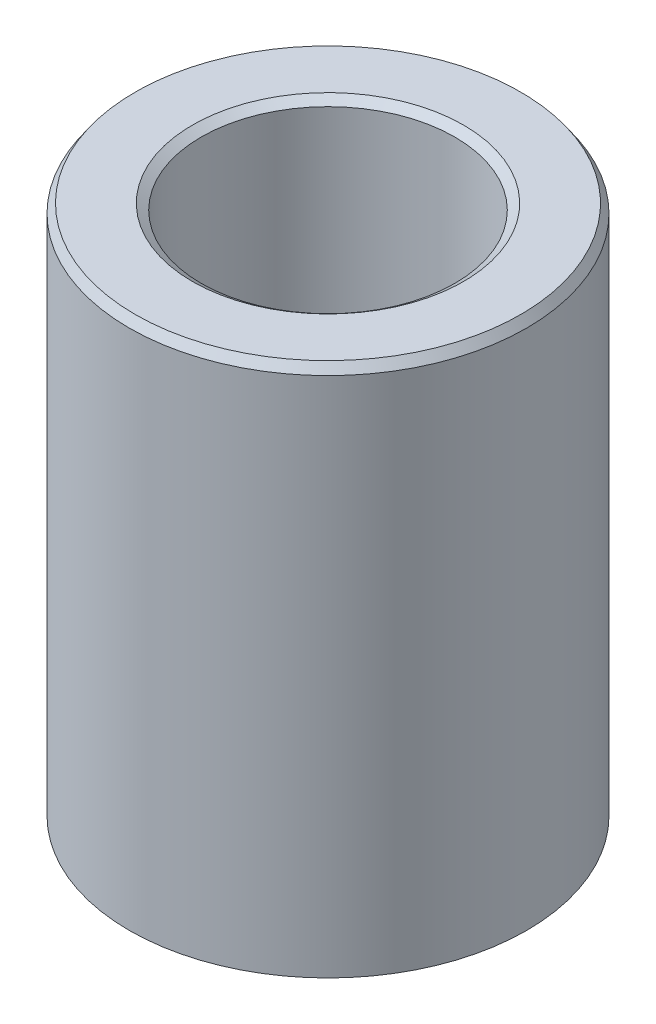
from build123d import *
from OCP.BRepFilletAPI import BRepFilletAPI_MakeChamfer

# Parameters (mm, degrees)
SKETCH1_R           = 47.5
BOSS_EXTRUDE1_DEPTH = 128.229420017
SKETCH2_R           = 30.314714834
CUT_EXTRUDE1_DEPTH  = 145.759400931
CHAMFER1_SIZE       = 2.090935507
CHAMFER1_SIZE2      = 1.429534085


with BuildPart() as part:
    # Sketch1 → Boss-Extrude1 (new body)
    with BuildSketch(Plane(origin=(0, 0, 0), x_dir=(1, 0, 0), z_dir=(0, 1, 0))):
        Circle(SKETCH1_R)
    extrude(amount=BOSS_EXTRUDE1_DEPTH)

    # Sketch2 → Cut-Extrude1 (cut, through all)
    with BuildSketch(Plane(origin=(0, 0, 0), x_dir=(1, 0, 0), z_dir=(0, 1, 0))):
        Circle(SKETCH2_R)
    extrude(amount=CUT_EXTRUDE1_DEPTH, mode=Mode.SUBTRACT)

    # Chamfer1: one chamfer whose edges measure the first distance from different faces: ONE call of the kernel's chamfer builder (chamfer() names one face for all edges)
    chamfer1_edges_1 = [part.edges().sort_by_distance(p)[0] for p in [
        (-30.314714834, 128.229420017, 0),
    ]]
    chamfer1_side_1 = [part.faces().sort_by_distance(p)[0] for p in [
        (-46.156497116, 128.229420017, 0),
    ]]
    chamfer1_edges_2 = [part.edges().sort_by_distance(p)[0] for p in [
        (-30.314714834, 0, 0),
    ]]
    chamfer1_side_2 = [part.faces().sort_by_distance(p)[0] for p in [
        (-30.314714834, 64.114710009, 0),
    ]]
    chamfer1_edges_3 = [part.edges().sort_by_distance(p)[0] for p in [
        (-47.5, 0, 0),
    ]]
    chamfer1_side_3 = [part.faces().sort_by_distance(p)[0] for p in [
        (-46.156497116, 0, 0),
    ]]
    chamfer1_edges_4 = [part.edges().sort_by_distance(p)[0] for p in [
        (-47.5, 128.229420017, 0),
    ]]
    chamfer1_side_4 = [part.faces().sort_by_distance(p)[0] for p in [
        (-47.5, 64.114710009, 0),
    ]]
    chamfer1 = BRepFilletAPI_MakeChamfer(part.part.solid().wrapped)
    for e in chamfer1_edges_1:
        chamfer1.Add(CHAMFER1_SIZE, CHAMFER1_SIZE2, e.wrapped, chamfer1_side_1[0].wrapped)  # the first distance lies on this face
    for e in chamfer1_edges_2:
        chamfer1.Add(CHAMFER1_SIZE, CHAMFER1_SIZE2, e.wrapped, chamfer1_side_2[0].wrapped)  # the first distance lies on this face
    for e in chamfer1_edges_3:
        chamfer1.Add(CHAMFER1_SIZE, CHAMFER1_SIZE2, e.wrapped, chamfer1_side_3[0].wrapped)  # the first distance lies on this face
    for e in chamfer1_edges_4:
        chamfer1.Add(CHAMFER1_SIZE, CHAMFER1_SIZE2, e.wrapped, chamfer1_side_4[0].wrapped)  # the first distance lies on this face
    add(Compound.cast(chamfer1.Shape()), mode=Mode.REPLACE)


solid = part.part
